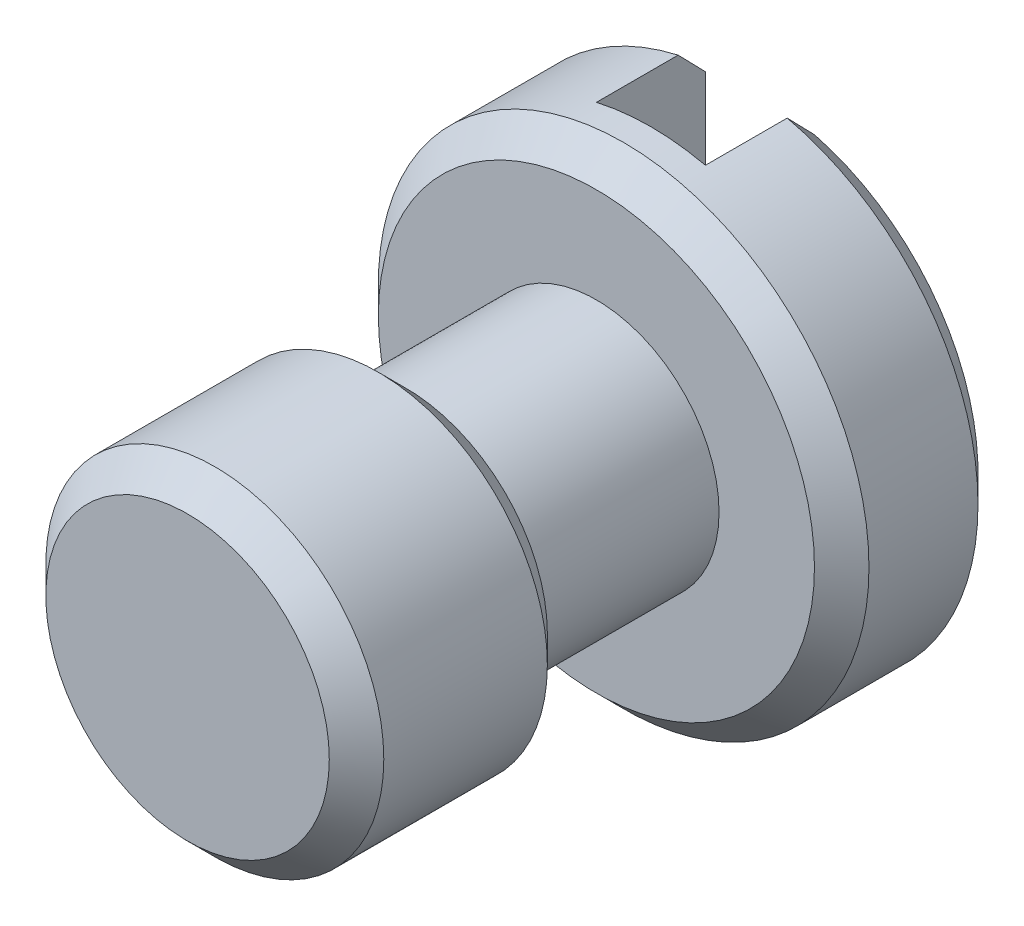
from build123d import *

# Parameters (mm, degrees)
SKETCH_1_R          = 4.5
EXTRUDE_1_DEPTH     = 3
SKETCH_2_R          = 2.25
EXTRUDE_2_DEPTH     = 3.5
SKETCH_3_R          = 3.1
EXTRUDE_3_DEPTH     = 4
CHAMFER_1_SIZE      = 0.5
SKETCH_4_W          = 2
SKETCH_4_H          = 10.520514376
CUT_EXTRUDE_1_DEPTH = 2


with BuildPart() as part:
    # Эскиз1 → Бобышка-Вытянуть1 (new body)
    with BuildSketch(Plane.XY):
        Circle(SKETCH_1_R)
    extrude(amount=EXTRUDE_1_DEPTH)

    # Эскиз2 → Бобышка-Вытянуть2 (add)
    with BuildSketch(Plane.XY.offset(3)):
        Circle(SKETCH_2_R)
    extrude(amount=EXTRUDE_2_DEPTH)

    # Эскиз3 → Бобышка-Вытянуть3 (add)
    with BuildSketch(Plane.XY.offset(6.5)):
        Circle(SKETCH_3_R)
    extrude(amount=EXTRUDE_3_DEPTH)

    # Фаска1
    chamfer_1_edges = [part.edges().sort_by_distance(p)[0] for p in [
        (-3.1, 0, 10.5),
        (-3.1, 0, 6.5),
        (-4.5, 0, 3),
        (-4.5, 0, 0),
    ]]
    chamfer(chamfer_1_edges, length=CHAMFER_1_SIZE)

    # Эскиз4 → Вырез-Вытянуть1 (cut)
    with BuildSketch(Plane(origin=(0, 0, 0), x_dir=(-1, 0, 0), z_dir=(0, 0, -1))):
        Rectangle(SKETCH_4_W, SKETCH_4_H)
    extrude(amount=-CUT_EXTRUDE_1_DEPTH, mode=Mode.SUBTRACT)


solid = part.part
